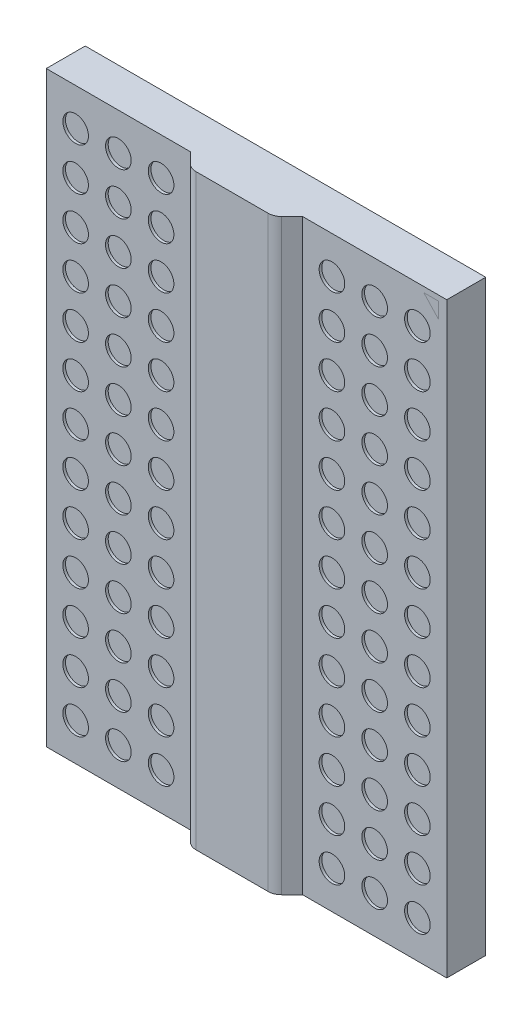
from build123d import *

# Parameters (mm, degrees)
SKETCH1_W                = 7.5
SKETCH1_H                = 11
BOSS_EXTRUDE1_DEPTH      = 1.1
SKETCH2_W                = 2.7
SKETCH2_H                = 11
CUT_EXTRUDE1_DEPTH       = 0.37
SKETCH3_W                = 2.1
SKETCH3_H                = 11
CUT_EXTRUDE2_DEPTH       = 0.1
CHAMFER1_SIZE            = 0.27
FILLET1_R                = 0.25
SKETCH4_R                = 0.24
CUT_EXTRUDE3_DEPTH       = 0.05
LPATTERN1_COUNT          = 3
LPATTERN1_PITCH          = 0.8
LPATTERN1_COUNT_DIR2     = 7
LPATTERN1_PITCH_DIR2     = 0.8
MIRROR1_COPY_1_SKETCH_R  = 0.24
MIRROR1_COPY_1_DEPTH     = 0.05
MIRROR1_COPY_2_SKETCH_R  = 0.24
MIRROR1_COPY_2_DEPTH     = 0.05
MIRROR1_COPY_3_SKETCH_R  = 0.24
MIRROR1_COPY_3_DEPTH     = 0.05
MIRROR1_COPY_4_SKETCH_R  = 0.24
MIRROR1_COPY_4_DEPTH     = 0.05
MIRROR1_COPY_5_SKETCH_R  = 0.24
MIRROR1_COPY_5_DEPTH     = 0.05
MIRROR1_COPY_6_SKETCH_R  = 0.24
MIRROR1_COPY_6_DEPTH     = 0.05
MIRROR1_COPY_7_SKETCH_R  = 0.24
MIRROR1_COPY_7_DEPTH     = 0.05
MIRROR1_COPY_8_SKETCH_R  = 0.24
MIRROR1_COPY_8_DEPTH     = 0.05
MIRROR1_COPY_9_SKETCH_R  = 0.24
MIRROR1_COPY_9_DEPTH     = 0.05
MIRROR1_COPY_10_SKETCH_R = 0.24
MIRROR1_COPY_10_DEPTH    = 0.05
MIRROR1_COPY_11_SKETCH_R = 0.24
MIRROR1_COPY_11_DEPTH    = 0.05
MIRROR1_COPY_12_SKETCH_R = 0.24
MIRROR1_COPY_12_DEPTH    = 0.05
MIRROR1_COPY_13_SKETCH_R = 0.24
MIRROR1_COPY_13_DEPTH    = 0.05
MIRROR1_COPY_14_SKETCH_R = 0.24
MIRROR1_COPY_14_DEPTH    = 0.05
MIRROR1_COPY_15_SKETCH_R = 0.24
MIRROR1_COPY_15_DEPTH    = 0.05
MIRROR1_COPY_16_SKETCH_R = 0.24
MIRROR1_COPY_16_DEPTH    = 0.05
MIRROR1_COPY_17_SKETCH_R = 0.24
MIRROR1_COPY_17_DEPTH    = 0.05
MIRROR1_COPY_18_SKETCH_R = 0.24
MIRROR1_COPY_18_DEPTH    = 0.05
MIRROR1_COPY_19_SKETCH_R = 0.24
MIRROR1_COPY_19_DEPTH    = 0.05
MIRROR1_COPY_20_SKETCH_R = 0.24
MIRROR1_COPY_20_DEPTH    = 0.05
MIRROR1_COPY_21_SKETCH_R = 0.24
MIRROR1_COPY_21_DEPTH    = 0.05
MIRROR2_COPY_1_SKETCH_R  = 0.24
MIRROR2_COPY_1_DEPTH     = 0.05
MIRROR2_COPY_2_SKETCH_R  = 0.24
MIRROR2_COPY_2_DEPTH     = 0.05
MIRROR2_COPY_3_SKETCH_R  = 0.24
MIRROR2_COPY_3_DEPTH     = 0.05
MIRROR2_COPY_4_SKETCH_R  = 0.24
MIRROR2_COPY_4_DEPTH     = 0.05
MIRROR2_COPY_5_SKETCH_R  = 0.24
MIRROR2_COPY_5_DEPTH     = 0.05
MIRROR2_COPY_6_SKETCH_R  = 0.24
MIRROR2_COPY_6_DEPTH     = 0.05
MIRROR2_COPY_7_SKETCH_R  = 0.24
MIRROR2_COPY_7_DEPTH     = 0.05
MIRROR2_COPY_8_SKETCH_R  = 0.24
MIRROR2_COPY_8_DEPTH     = 0.05
MIRROR2_COPY_9_SKETCH_R  = 0.24
MIRROR2_COPY_9_DEPTH     = 0.05
MIRROR2_COPY_10_SKETCH_R = 0.24
MIRROR2_COPY_10_DEPTH    = 0.05
MIRROR2_COPY_11_SKETCH_R = 0.24
MIRROR2_COPY_11_DEPTH    = 0.05
MIRROR2_COPY_12_SKETCH_R = 0.24
MIRROR2_COPY_12_DEPTH    = 0.05
MIRROR2_COPY_13_SKETCH_R = 0.24
MIRROR2_COPY_13_DEPTH    = 0.05
MIRROR2_COPY_14_SKETCH_R = 0.24
MIRROR2_COPY_14_DEPTH    = 0.05
MIRROR2_COPY_15_SKETCH_R = 0.24
MIRROR2_COPY_15_DEPTH    = 0.05
MIRROR2_COPY_16_SKETCH_R = 0.24
MIRROR2_COPY_16_DEPTH    = 0.05
MIRROR2_COPY_17_SKETCH_R = 0.24
MIRROR2_COPY_17_DEPTH    = 0.05
MIRROR2_COPY_18_SKETCH_R = 0.24
MIRROR2_COPY_18_DEPTH    = 0.05
MIRROR2_COPY_19_SKETCH_R = 0.24
MIRROR2_COPY_19_DEPTH    = 0.05
MIRROR2_COPY_20_SKETCH_R = 0.24
MIRROR2_COPY_20_DEPTH    = 0.05
MIRROR2_COPY_21_SKETCH_R = 0.24
MIRROR2_COPY_21_DEPTH    = 0.05
MIRROR2_COPY_22_SKETCH_R = 0.24
MIRROR2_COPY_22_DEPTH    = 0.05
MIRROR2_COPY_23_SKETCH_R = 0.24
MIRROR2_COPY_23_DEPTH    = 0.05
MIRROR2_COPY_24_SKETCH_R = 0.24
MIRROR2_COPY_24_DEPTH    = 0.05
MIRROR2_COPY_25_SKETCH_R = 0.24
MIRROR2_COPY_25_DEPTH    = 0.05
MIRROR2_COPY_26_SKETCH_R = 0.24
MIRROR2_COPY_26_DEPTH    = 0.05
MIRROR2_COPY_27_SKETCH_R = 0.24
MIRROR2_COPY_27_DEPTH    = 0.05
MIRROR2_COPY_28_SKETCH_R = 0.24
MIRROR2_COPY_28_DEPTH    = 0.05
MIRROR2_COPY_29_SKETCH_R = 0.24
MIRROR2_COPY_29_DEPTH    = 0.05
MIRROR2_COPY_30_SKETCH_R = 0.24
MIRROR2_COPY_30_DEPTH    = 0.05
MIRROR2_COPY_31_SKETCH_R = 0.24
MIRROR2_COPY_31_DEPTH    = 0.05
MIRROR2_COPY_32_SKETCH_R = 0.24
MIRROR2_COPY_32_DEPTH    = 0.05
MIRROR2_COPY_33_SKETCH_R = 0.24
MIRROR2_COPY_33_DEPTH    = 0.05
MIRROR2_COPY_34_SKETCH_R = 0.24
MIRROR2_COPY_34_DEPTH    = 0.05
MIRROR2_COPY_35_SKETCH_R = 0.24
MIRROR2_COPY_35_DEPTH    = 0.05
MIRROR2_COPY_36_SKETCH_R = 0.24
MIRROR2_COPY_36_DEPTH    = 0.05
MIRROR2_COPY_37_SKETCH_R = 0.24
MIRROR2_COPY_37_DEPTH    = 0.05
MIRROR2_COPY_38_SKETCH_R = 0.24
MIRROR2_COPY_38_DEPTH    = 0.05
MIRROR2_COPY_39_SKETCH_R = 0.24
MIRROR2_COPY_39_DEPTH    = 0.05
MIRROR2_COPY_40_SKETCH_R = 0.24
MIRROR2_COPY_40_DEPTH    = 0.05
MIRROR2_COPY_41_SKETCH_R = 0.24
MIRROR2_COPY_41_DEPTH    = 0.05
MIRROR2_COPY_42_SKETCH_R = 0.24
MIRROR2_COPY_42_DEPTH    = 0.05
MIRROR2_COPY_43_SKETCH_R = 0.24
MIRROR2_COPY_43_DEPTH    = 0.05


with BuildPart() as part:
    # Sketch1 → Boss-Extrude1 (new body)
    with BuildSketch(Plane.XY):
        Rectangle(SKETCH1_W, SKETCH1_H)
    extrude(amount=BOSS_EXTRUDE1_DEPTH)

    # Sketch2 → Cut-Extrude1 (cut)
    with BuildSketch(Plane.XY.offset(1.1)):
        with Locations((-2.4, 0)):
            Rectangle(SKETCH2_W, SKETCH2_H)
        with Locations((2.4, 0)):
            Rectangle(SKETCH2_W, SKETCH2_H)
    extrude(amount=-CUT_EXTRUDE1_DEPTH, mode=Mode.SUBTRACT)

    # Sketch3 → Cut-Extrude2 (cut)
    with BuildSketch(Plane.XY.offset(1.1)):
        Rectangle(SKETCH3_W, SKETCH3_H)
    extrude(amount=-CUT_EXTRUDE2_DEPTH, mode=Mode.SUBTRACT)

    # Chamfer1
    chamfer1_edges = [part.edges().sort_by_distance(p)[0] for p in [
        (1.05, 0, 1),
        (-1.05, 0, 1),
    ]]
    chamfer(chamfer1_edges, length=CHAMFER1_SIZE - 0.0001)  # a hair under: the kernel refuses the full size

    # Fillet1
    fillet1_edges = [part.edges().sort_by_distance(p)[0] for p in [
        (-0.7801, 0, 1),
        (0.7801, 0, 1),
    ]]
    fillet(fillet1_edges, radius=FILLET1_R)

    # Sketch4 → Cut-Extrude3 (cut)
    with BuildSketch(Plane.XY.offset(0.73)):
        with Locations((-1.6, 0)):
            Circle(SKETCH4_R)
    cut_extrude3 = extrude(amount=-CUT_EXTRUDE3_DEPTH, mode=Mode.SUBTRACT)

    # LPattern1: Cut-Extrude3 3 × 7
    with Locations(*[(-i * LPATTERN1_PITCH, -j * LPATTERN1_PITCH_DIR2, 0) for i in range(LPATTERN1_COUNT) for j in range(LPATTERN1_COUNT_DIR2) if (i, j) != (0, 0)]):
        add(cut_extrude3, mode=Mode.SUBTRACT)

    # Mirror1 copy 1 sketch → Mirror1 copy 1 (cut)
    with BuildSketch(Plane(origin=(0, 0.8, 0.73), x_dir=(1, 0, 0), z_dir=(0, 0, 1))):
        with Locations((-1.6, 0)):
            Circle(MIRROR1_COPY_1_SKETCH_R)
    extrude(amount=-MIRROR1_COPY_1_DEPTH, mode=Mode.SUBTRACT)

    # Mirror1 copy 2 sketch → Mirror1 copy 2 (cut)
    with BuildSketch(Plane(origin=(0, 1.6, 0.73), x_dir=(1, 0, 0), z_dir=(0, 0, 1))):
        with Locations((-1.6, 0)):
            Circle(MIRROR1_COPY_2_SKETCH_R)
    extrude(amount=-MIRROR1_COPY_2_DEPTH, mode=Mode.SUBTRACT)

    # Mirror1 copy 3 sketch → Mirror1 copy 3 (cut)
    with BuildSketch(Plane(origin=(0, 2.4, 0.73), x_dir=(1, 0, 0), z_dir=(0, 0, 1))):
        with Locations((-1.6, 0)):
            Circle(MIRROR1_COPY_3_SKETCH_R)
    extrude(amount=-MIRROR1_COPY_3_DEPTH, mode=Mode.SUBTRACT)

    # Mirror1 copy 4 sketch → Mirror1 copy 4 (cut)
    with BuildSketch(Plane(origin=(0, 3.2, 0.73), x_dir=(1, 0, 0), z_dir=(0, 0, 1))):
        with Locations((-1.6, 0)):
            Circle(MIRROR1_COPY_4_SKETCH_R)
    extrude(amount=-MIRROR1_COPY_4_DEPTH, mode=Mode.SUBTRACT)

    # Mirror1 copy 5 sketch → Mirror1 copy 5 (cut)
    with BuildSketch(Plane(origin=(0, 4, 0.73), x_dir=(1, 0, 0), z_dir=(0, 0, 1))):
        with Locations((-1.6, 0)):
            Circle(MIRROR1_COPY_5_SKETCH_R)
    extrude(amount=-MIRROR1_COPY_5_DEPTH, mode=Mode.SUBTRACT)

    # Mirror1 copy 6 sketch → Mirror1 copy 6 (cut)
    with BuildSketch(Plane(origin=(0, 4.8, 0.73), x_dir=(1, 0, 0), z_dir=(0, 0, 1))):
        with Locations((-1.6, 0)):
            Circle(MIRROR1_COPY_6_SKETCH_R)
    extrude(amount=-MIRROR1_COPY_6_DEPTH, mode=Mode.SUBTRACT)

    # Mirror1 copy 7 sketch → Mirror1 copy 7 (cut)
    with BuildSketch(Plane(origin=(-0.8, 0, 0.73), x_dir=(1, 0, 0), z_dir=(0, 0, 1))):
        with Locations((-1.6, 0)):
            Circle(MIRROR1_COPY_7_SKETCH_R)
    extrude(amount=-MIRROR1_COPY_7_DEPTH, mode=Mode.SUBTRACT)

    # Mirror1 copy 8 sketch → Mirror1 copy 8 (cut)
    with BuildSketch(Plane(origin=(-0.8, 0.8, 0.73), x_dir=(1, 0, 0), z_dir=(0, 0, 1))):
        with Locations((-1.6, 0)):
            Circle(MIRROR1_COPY_8_SKETCH_R)
    extrude(amount=-MIRROR1_COPY_8_DEPTH, mode=Mode.SUBTRACT)

    # Mirror1 copy 9 sketch → Mirror1 copy 9 (cut)
    with BuildSketch(Plane(origin=(-0.8, 1.6, 0.73), x_dir=(1, 0, 0), z_dir=(0, 0, 1))):
        with Locations((-1.6, 0)):
            Circle(MIRROR1_COPY_9_SKETCH_R)
    extrude(amount=-MIRROR1_COPY_9_DEPTH, mode=Mode.SUBTRACT)

    # Mirror1 copy 10 sketch → Mirror1 copy 10 (cut)
    with BuildSketch(Plane(origin=(-0.8, 2.4, 0.73), x_dir=(1, 0, 0), z_dir=(0, 0, 1))):
        with Locations((-1.6, 0)):
            Circle(MIRROR1_COPY_10_SKETCH_R)
    extrude(amount=-MIRROR1_COPY_10_DEPTH, mode=Mode.SUBTRACT)

    # Mirror1 copy 11 sketch → Mirror1 copy 11 (cut)
    with BuildSketch(Plane(origin=(-0.8, 3.2, 0.73), x_dir=(1, 0, 0), z_dir=(0, 0, 1))):
        with Locations((-1.6, 0)):
            Circle(MIRROR1_COPY_11_SKETCH_R)
    extrude(amount=-MIRROR1_COPY_11_DEPTH, mode=Mode.SUBTRACT)

    # Mirror1 copy 12 sketch → Mirror1 copy 12 (cut)
    with BuildSketch(Plane(origin=(-0.8, 4, 0.73), x_dir=(1, 0, 0), z_dir=(0, 0, 1))):
        with Locations((-1.6, 0)):
            Circle(MIRROR1_COPY_12_SKETCH_R)
    extrude(amount=-MIRROR1_COPY_12_DEPTH, mode=Mode.SUBTRACT)

    # Mirror1 copy 13 sketch → Mirror1 copy 13 (cut)
    with BuildSketch(Plane(origin=(-0.8, 4.8, 0.73), x_dir=(1, 0, 0), z_dir=(0, 0, 1))):
        with Locations((-1.6, 0)):
            Circle(MIRROR1_COPY_13_SKETCH_R)
    extrude(amount=-MIRROR1_COPY_13_DEPTH, mode=Mode.SUBTRACT)

    # Mirror1 copy 14 sketch → Mirror1 copy 14 (cut)
    with BuildSketch(Plane(origin=(-1.6, 0, 0.73), x_dir=(1, 0, 0), z_dir=(0, 0, 1))):
        with Locations((-1.6, 0)):
            Circle(MIRROR1_COPY_14_SKETCH_R)
    extrude(amount=-MIRROR1_COPY_14_DEPTH, mode=Mode.SUBTRACT)

    # Mirror1 copy 15 sketch → Mirror1 copy 15 (cut)
    with BuildSketch(Plane(origin=(-1.6, 0.8, 0.73), x_dir=(1, 0, 0), z_dir=(0, 0, 1))):
        with Locations((-1.6, 0)):
            Circle(MIRROR1_COPY_15_SKETCH_R)
    extrude(amount=-MIRROR1_COPY_15_DEPTH, mode=Mode.SUBTRACT)

    # Mirror1 copy 16 sketch → Mirror1 copy 16 (cut)
    with BuildSketch(Plane(origin=(-1.6, 1.6, 0.73), x_dir=(1, 0, 0), z_dir=(0, 0, 1))):
        with Locations((-1.6, 0)):
            Circle(MIRROR1_COPY_16_SKETCH_R)
    extrude(amount=-MIRROR1_COPY_16_DEPTH, mode=Mode.SUBTRACT)

    # Mirror1 copy 17 sketch → Mirror1 copy 17 (cut)
    with BuildSketch(Plane(origin=(-1.6, 2.4, 0.73), x_dir=(1, 0, 0), z_dir=(0, 0, 1))):
        with Locations((-1.6, 0)):
            Circle(MIRROR1_COPY_17_SKETCH_R)
    extrude(amount=-MIRROR1_COPY_17_DEPTH, mode=Mode.SUBTRACT)

    # Mirror1 copy 18 sketch → Mirror1 copy 18 (cut)
    with BuildSketch(Plane(origin=(-1.6, 3.2, 0.73), x_dir=(1, 0, 0), z_dir=(0, 0, 1))):
        with Locations((-1.6, 0)):
            Circle(MIRROR1_COPY_18_SKETCH_R)
    extrude(amount=-MIRROR1_COPY_18_DEPTH, mode=Mode.SUBTRACT)

    # Mirror1 copy 19 sketch → Mirror1 copy 19 (cut)
    with BuildSketch(Plane(origin=(-1.6, 4, 0.73), x_dir=(1, 0, 0), z_dir=(0, 0, 1))):
        with Locations((-1.6, 0)):
            Circle(MIRROR1_COPY_19_SKETCH_R)
    extrude(amount=-MIRROR1_COPY_19_DEPTH, mode=Mode.SUBTRACT)

    # Mirror1 copy 20 sketch → Mirror1 copy 20 (cut)
    with BuildSketch(Plane(origin=(-1.6, 4.8, 0.73), x_dir=(1, 0, 0), z_dir=(0, 0, 1))):
        with Locations((-1.6, 0)):
            Circle(MIRROR1_COPY_20_SKETCH_R)
    extrude(amount=-MIRROR1_COPY_20_DEPTH, mode=Mode.SUBTRACT)

    # Mirror1 copy 21 sketch → Mirror1 copy 21 (cut)
    with BuildSketch(Plane.XY.offset(0.73)):
        with Locations((-1.6, 0)):
            Circle(MIRROR1_COPY_21_SKETCH_R)
    extrude(amount=-MIRROR1_COPY_21_DEPTH, mode=Mode.SUBTRACT)

    # Mirror2 copy 1 sketch → Mirror2 copy 1 (cut)
    with BuildSketch(Plane(origin=(0, -0.8, 0.73), x_dir=(-1, 0, 0), z_dir=(0, 0, 1))):
        with Locations((-1.6, 0)):
            Circle(MIRROR2_COPY_1_SKETCH_R)
    extrude(amount=-MIRROR2_COPY_1_DEPTH, mode=Mode.SUBTRACT)

    # Mirror2 copy 2 sketch → Mirror2 copy 2 (cut)
    with BuildSketch(Plane(origin=(0, -1.6, 0.73), x_dir=(-1, 0, 0), z_dir=(0, 0, 1))):
        with Locations((-1.6, 0)):
            Circle(MIRROR2_COPY_2_SKETCH_R)
    extrude(amount=-MIRROR2_COPY_2_DEPTH, mode=Mode.SUBTRACT)

    # Mirror2 copy 3 sketch → Mirror2 copy 3 (cut)
    with BuildSketch(Plane(origin=(0, -2.4, 0.73), x_dir=(-1, 0, 0), z_dir=(0, 0, 1))):
        with Locations((-1.6, 0)):
            Circle(MIRROR2_COPY_3_SKETCH_R)
    extrude(amount=-MIRROR2_COPY_3_DEPTH, mode=Mode.SUBTRACT)

    # Mirror2 copy 4 sketch → Mirror2 copy 4 (cut)
    with BuildSketch(Plane(origin=(0, -3.2, 0.73), x_dir=(-1, 0, 0), z_dir=(0, 0, 1))):
        with Locations((-1.6, 0)):
            Circle(MIRROR2_COPY_4_SKETCH_R)
    extrude(amount=-MIRROR2_COPY_4_DEPTH, mode=Mode.SUBTRACT)

    # Mirror2 copy 5 sketch → Mirror2 copy 5 (cut)
    with BuildSketch(Plane(origin=(0, -4, 0.73), x_dir=(-1, 0, 0), z_dir=(0, 0, 1))):
        with Locations((-1.6, 0)):
            Circle(MIRROR2_COPY_5_SKETCH_R)
    extrude(amount=-MIRROR2_COPY_5_DEPTH, mode=Mode.SUBTRACT)

    # Mirror2 copy 6 sketch → Mirror2 copy 6 (cut)
    with BuildSketch(Plane(origin=(0, -4.8, 0.73), x_dir=(-1, 0, 0), z_dir=(0, 0, 1))):
        with Locations((-1.6, 0)):
            Circle(MIRROR2_COPY_6_SKETCH_R)
    extrude(amount=-MIRROR2_COPY_6_DEPTH, mode=Mode.SUBTRACT)

    # Mirror2 copy 7 sketch → Mirror2 copy 7 (cut)
    with BuildSketch(Plane(origin=(0.8, 0, 0.73), x_dir=(-1, 0, 0), z_dir=(0, 0, 1))):
        with Locations((-1.6, 0)):
            Circle(MIRROR2_COPY_7_SKETCH_R)
    extrude(amount=-MIRROR2_COPY_7_DEPTH, mode=Mode.SUBTRACT)

    # Mirror2 copy 8 sketch → Mirror2 copy 8 (cut)
    with BuildSketch(Plane(origin=(0.8, -0.8, 0.73), x_dir=(-1, 0, 0), z_dir=(0, 0, 1))):
        with Locations((-1.6, 0)):
            Circle(MIRROR2_COPY_8_SKETCH_R)
    extrude(amount=-MIRROR2_COPY_8_DEPTH, mode=Mode.SUBTRACT)

    # Mirror2 copy 9 sketch → Mirror2 copy 9 (cut)
    with BuildSketch(Plane(origin=(0.8, -1.6, 0.73), x_dir=(-1, 0, 0), z_dir=(0, 0, 1))):
        with Locations((-1.6, 0)):
            Circle(MIRROR2_COPY_9_SKETCH_R)
    extrude(amount=-MIRROR2_COPY_9_DEPTH, mode=Mode.SUBTRACT)

    # Mirror2 copy 10 sketch → Mirror2 copy 10 (cut)
    with BuildSketch(Plane(origin=(0.8, -2.4, 0.73), x_dir=(-1, 0, 0), z_dir=(0, 0, 1))):
        with Locations((-1.6, 0)):
            Circle(MIRROR2_COPY_10_SKETCH_R)
    extrude(amount=-MIRROR2_COPY_10_DEPTH, mode=Mode.SUBTRACT)

    # Mirror2 copy 11 sketch → Mirror2 copy 11 (cut)
    with BuildSketch(Plane(origin=(0.8, -3.2, 0.73), x_dir=(-1, 0, 0), z_dir=(0, 0, 1))):
        with Locations((-1.6, 0)):
            Circle(MIRROR2_COPY_11_SKETCH_R)
    extrude(amount=-MIRROR2_COPY_11_DEPTH, mode=Mode.SUBTRACT)

    # Mirror2 copy 12 sketch → Mirror2 copy 12 (cut)
    with BuildSketch(Plane(origin=(0.8, -4, 0.73), x_dir=(-1, 0, 0), z_dir=(0, 0, 1))):
        with Locations((-1.6, 0)):
            Circle(MIRROR2_COPY_12_SKETCH_R)
    extrude(amount=-MIRROR2_COPY_12_DEPTH, mode=Mode.SUBTRACT)

    # Mirror2 copy 13 sketch → Mirror2 copy 13 (cut)
    with BuildSketch(Plane(origin=(0.8, -4.8, 0.73), x_dir=(-1, 0, 0), z_dir=(0, 0, 1))):
        with Locations((-1.6, 0)):
            Circle(MIRROR2_COPY_13_SKETCH_R)
    extrude(amount=-MIRROR2_COPY_13_DEPTH, mode=Mode.SUBTRACT)

    # Mirror2 copy 14 sketch → Mirror2 copy 14 (cut)
    with BuildSketch(Plane(origin=(1.6, 0, 0.73), x_dir=(-1, 0, 0), z_dir=(0, 0, 1))):
        with Locations((-1.6, 0)):
            Circle(MIRROR2_COPY_14_SKETCH_R)
    extrude(amount=-MIRROR2_COPY_14_DEPTH, mode=Mode.SUBTRACT)

    # Mirror2 copy 15 sketch → Mirror2 copy 15 (cut)
    with BuildSketch(Plane(origin=(1.6, -0.8, 0.73), x_dir=(-1, 0, 0), z_dir=(0, 0, 1))):
        with Locations((-1.6, 0)):
            Circle(MIRROR2_COPY_15_SKETCH_R)
    extrude(amount=-MIRROR2_COPY_15_DEPTH, mode=Mode.SUBTRACT)

    # Mirror2 copy 16 sketch → Mirror2 copy 16 (cut)
    with BuildSketch(Plane(origin=(1.6, -1.6, 0.73), x_dir=(-1, 0, 0), z_dir=(0, 0, 1))):
        with Locations((-1.6, 0)):
            Circle(MIRROR2_COPY_16_SKETCH_R)
    extrude(amount=-MIRROR2_COPY_16_DEPTH, mode=Mode.SUBTRACT)

    # Mirror2 copy 17 sketch → Mirror2 copy 17 (cut)
    with BuildSketch(Plane(origin=(1.6, -2.4, 0.73), x_dir=(-1, 0, 0), z_dir=(0, 0, 1))):
        with Locations((-1.6, 0)):
            Circle(MIRROR2_COPY_17_SKETCH_R)
    extrude(amount=-MIRROR2_COPY_17_DEPTH, mode=Mode.SUBTRACT)

    # Mirror2 copy 18 sketch → Mirror2 copy 18 (cut)
    with BuildSketch(Plane(origin=(1.6, -3.2, 0.73), x_dir=(-1, 0, 0), z_dir=(0, 0, 1))):
        with Locations((-1.6, 0)):
            Circle(MIRROR2_COPY_18_SKETCH_R)
    extrude(amount=-MIRROR2_COPY_18_DEPTH, mode=Mode.SUBTRACT)

    # Mirror2 copy 19 sketch → Mirror2 copy 19 (cut)
    with BuildSketch(Plane(origin=(1.6, -4, 0.73), x_dir=(-1, 0, 0), z_dir=(0, 0, 1))):
        with Locations((-1.6, 0)):
            Circle(MIRROR2_COPY_19_SKETCH_R)
    extrude(amount=-MIRROR2_COPY_19_DEPTH, mode=Mode.SUBTRACT)

    # Mirror2 copy 20 sketch → Mirror2 copy 20 (cut)
    with BuildSketch(Plane(origin=(1.6, -4.8, 0.73), x_dir=(-1, 0, 0), z_dir=(0, 0, 1))):
        with Locations((-1.6, 0)):
            Circle(MIRROR2_COPY_20_SKETCH_R)
    extrude(amount=-MIRROR2_COPY_20_DEPTH, mode=Mode.SUBTRACT)

    # Mirror2 copy 21 sketch → Mirror2 copy 21 (cut)
    with BuildSketch(Plane(origin=(0, 0, 0.73), x_dir=(-1, 0, 0), z_dir=(0, 0, 1))):
        with Locations((-1.6, 0)):
            Circle(MIRROR2_COPY_21_SKETCH_R)
    extrude(amount=-MIRROR2_COPY_21_DEPTH, mode=Mode.SUBTRACT)

    # Mirror2 copy 22 sketch → Mirror2 copy 22 (cut)
    with BuildSketch(Plane(origin=(0, 0.8, 0.73), x_dir=(-1, 0, 0), z_dir=(0, 0, 1))):
        with Locations((-1.6, 0)):
            Circle(MIRROR2_COPY_22_SKETCH_R)
    extrude(amount=-MIRROR2_COPY_22_DEPTH, mode=Mode.SUBTRACT)

    # Mirror2 copy 23 sketch → Mirror2 copy 23 (cut)
    with BuildSketch(Plane(origin=(0, 1.6, 0.73), x_dir=(-1, 0, 0), z_dir=(0, 0, 1))):
        with Locations((-1.6, 0)):
            Circle(MIRROR2_COPY_23_SKETCH_R)
    extrude(amount=-MIRROR2_COPY_23_DEPTH, mode=Mode.SUBTRACT)

    # Mirror2 copy 24 sketch → Mirror2 copy 24 (cut)
    with BuildSketch(Plane(origin=(0, 2.4, 0.73), x_dir=(-1, 0, 0), z_dir=(0, 0, 1))):
        with Locations((-1.6, 0)):
            Circle(MIRROR2_COPY_24_SKETCH_R)
    extrude(amount=-MIRROR2_COPY_24_DEPTH, mode=Mode.SUBTRACT)

    # Mirror2 copy 25 sketch → Mirror2 copy 25 (cut)
    with BuildSketch(Plane(origin=(0, 3.2, 0.73), x_dir=(-1, 0, 0), z_dir=(0, 0, 1))):
        with Locations((-1.6, 0)):
            Circle(MIRROR2_COPY_25_SKETCH_R)
    extrude(amount=-MIRROR2_COPY_25_DEPTH, mode=Mode.SUBTRACT)

    # Mirror2 copy 26 sketch → Mirror2 copy 26 (cut)
    with BuildSketch(Plane(origin=(0, 4, 0.73), x_dir=(-1, 0, 0), z_dir=(0, 0, 1))):
        with Locations((-1.6, 0)):
            Circle(MIRROR2_COPY_26_SKETCH_R)
    extrude(amount=-MIRROR2_COPY_26_DEPTH, mode=Mode.SUBTRACT)

    # Mirror2 copy 27 sketch → Mirror2 copy 27 (cut)
    with BuildSketch(Plane(origin=(0, 4.8, 0.73), x_dir=(-1, 0, 0), z_dir=(0, 0, 1))):
        with Locations((-1.6, 0)):
            Circle(MIRROR2_COPY_27_SKETCH_R)
    extrude(amount=-MIRROR2_COPY_27_DEPTH, mode=Mode.SUBTRACT)

    # Mirror2 copy 28 sketch → Mirror2 copy 28 (cut)
    with BuildSketch(Plane(origin=(0.8, 0, 0.73), x_dir=(-1, 0, 0), z_dir=(0, 0, 1))):
        with Locations((-1.6, 0)):
            Circle(MIRROR2_COPY_28_SKETCH_R)
    extrude(amount=-MIRROR2_COPY_28_DEPTH, mode=Mode.SUBTRACT)

    # Mirror2 copy 29 sketch → Mirror2 copy 29 (cut)
    with BuildSketch(Plane(origin=(0.8, 0.8, 0.73), x_dir=(-1, 0, 0), z_dir=(0, 0, 1))):
        with Locations((-1.6, 0)):
            Circle(MIRROR2_COPY_29_SKETCH_R)
    extrude(amount=-MIRROR2_COPY_29_DEPTH, mode=Mode.SUBTRACT)

    # Mirror2 copy 30 sketch → Mirror2 copy 30 (cut)
    with BuildSketch(Plane(origin=(0.8, 1.6, 0.73), x_dir=(-1, 0, 0), z_dir=(0, 0, 1))):
        with Locations((-1.6, 0)):
            Circle(MIRROR2_COPY_30_SKETCH_R)
    extrude(amount=-MIRROR2_COPY_30_DEPTH, mode=Mode.SUBTRACT)

    # Mirror2 copy 31 sketch → Mirror2 copy 31 (cut)
    with BuildSketch(Plane(origin=(0.8, 2.4, 0.73), x_dir=(-1, 0, 0), z_dir=(0, 0, 1))):
        with Locations((-1.6, 0)):
            Circle(MIRROR2_COPY_31_SKETCH_R)
    extrude(amount=-MIRROR2_COPY_31_DEPTH, mode=Mode.SUBTRACT)

    # Mirror2 copy 32 sketch → Mirror2 copy 32 (cut)
    with BuildSketch(Plane(origin=(0.8, 3.2, 0.73), x_dir=(-1, 0, 0), z_dir=(0, 0, 1))):
        with Locations((-1.6, 0)):
            Circle(MIRROR2_COPY_32_SKETCH_R)
    extrude(amount=-MIRROR2_COPY_32_DEPTH, mode=Mode.SUBTRACT)

    # Mirror2 copy 33 sketch → Mirror2 copy 33 (cut)
    with BuildSketch(Plane(origin=(0.8, 4, 0.73), x_dir=(-1, 0, 0), z_dir=(0, 0, 1))):
        with Locations((-1.6, 0)):
            Circle(MIRROR2_COPY_33_SKETCH_R)
    extrude(amount=-MIRROR2_COPY_33_DEPTH, mode=Mode.SUBTRACT)

    # Mirror2 copy 34 sketch → Mirror2 copy 34 (cut)
    with BuildSketch(Plane(origin=(0.8, 4.8, 0.73), x_dir=(-1, 0, 0), z_dir=(0, 0, 1))):
        with Locations((-1.6, 0)):
            Circle(MIRROR2_COPY_34_SKETCH_R)
    extrude(amount=-MIRROR2_COPY_34_DEPTH, mode=Mode.SUBTRACT)

    # Mirror2 copy 35 sketch → Mirror2 copy 35 (cut)
    with BuildSketch(Plane(origin=(1.6, 0, 0.73), x_dir=(-1, 0, 0), z_dir=(0, 0, 1))):
        with Locations((-1.6, 0)):
            Circle(MIRROR2_COPY_35_SKETCH_R)
    extrude(amount=-MIRROR2_COPY_35_DEPTH, mode=Mode.SUBTRACT)

    # Mirror2 copy 36 sketch → Mirror2 copy 36 (cut)
    with BuildSketch(Plane(origin=(1.6, 0.8, 0.73), x_dir=(-1, 0, 0), z_dir=(0, 0, 1))):
        with Locations((-1.6, 0)):
            Circle(MIRROR2_COPY_36_SKETCH_R)
    extrude(amount=-MIRROR2_COPY_36_DEPTH, mode=Mode.SUBTRACT)

    # Mirror2 copy 37 sketch → Mirror2 copy 37 (cut)
    with BuildSketch(Plane(origin=(1.6, 1.6, 0.73), x_dir=(-1, 0, 0), z_dir=(0, 0, 1))):
        with Locations((-1.6, 0)):
            Circle(MIRROR2_COPY_37_SKETCH_R)
    extrude(amount=-MIRROR2_COPY_37_DEPTH, mode=Mode.SUBTRACT)

    # Mirror2 copy 38 sketch → Mirror2 copy 38 (cut)
    with BuildSketch(Plane(origin=(1.6, 2.4, 0.73), x_dir=(-1, 0, 0), z_dir=(0, 0, 1))):
        with Locations((-1.6, 0)):
            Circle(MIRROR2_COPY_38_SKETCH_R)
    extrude(amount=-MIRROR2_COPY_38_DEPTH, mode=Mode.SUBTRACT)

    # Mirror2 copy 39 sketch → Mirror2 copy 39 (cut)
    with BuildSketch(Plane(origin=(1.6, 3.2, 0.73), x_dir=(-1, 0, 0), z_dir=(0, 0, 1))):
        with Locations((-1.6, 0)):
            Circle(MIRROR2_COPY_39_SKETCH_R)
    extrude(amount=-MIRROR2_COPY_39_DEPTH, mode=Mode.SUBTRACT)

    # Mirror2 copy 40 sketch → Mirror2 copy 40 (cut)
    with BuildSketch(Plane(origin=(1.6, 4, 0.73), x_dir=(-1, 0, 0), z_dir=(0, 0, 1))):
        with Locations((-1.6, 0)):
            Circle(MIRROR2_COPY_40_SKETCH_R)
    extrude(amount=-MIRROR2_COPY_40_DEPTH, mode=Mode.SUBTRACT)

    # Mirror2 copy 41 sketch → Mirror2 copy 41 (cut)
    with BuildSketch(Plane(origin=(1.6, 4.8, 0.73), x_dir=(-1, 0, 0), z_dir=(0, 0, 1))):
        with Locations((-1.6, 0)):
            Circle(MIRROR2_COPY_41_SKETCH_R)
    extrude(amount=-MIRROR2_COPY_41_DEPTH, mode=Mode.SUBTRACT)

    # Mirror2 copy 42 sketch → Mirror2 copy 42 (cut)
    with BuildSketch(Plane(origin=(0, 0, 0.73), x_dir=(-1, 0, 0), z_dir=(0, 0, 1))):
        with Locations((-1.6, 0)):
            Circle(MIRROR2_COPY_42_SKETCH_R)
    extrude(amount=-MIRROR2_COPY_42_DEPTH, mode=Mode.SUBTRACT)

    # Mirror2 copy 43 sketch → Mirror2 copy 43 (cut)
    with BuildSketch(Plane(origin=(0, 0, 0.73), x_dir=(-1, 0, 0), z_dir=(0, 0, 1))):
        with Locations((-1.6, 0)):
            Circle(MIRROR2_COPY_43_SKETCH_R)
    extrude(amount=-MIRROR2_COPY_43_DEPTH, mode=Mode.SUBTRACT)


solid = part.part
